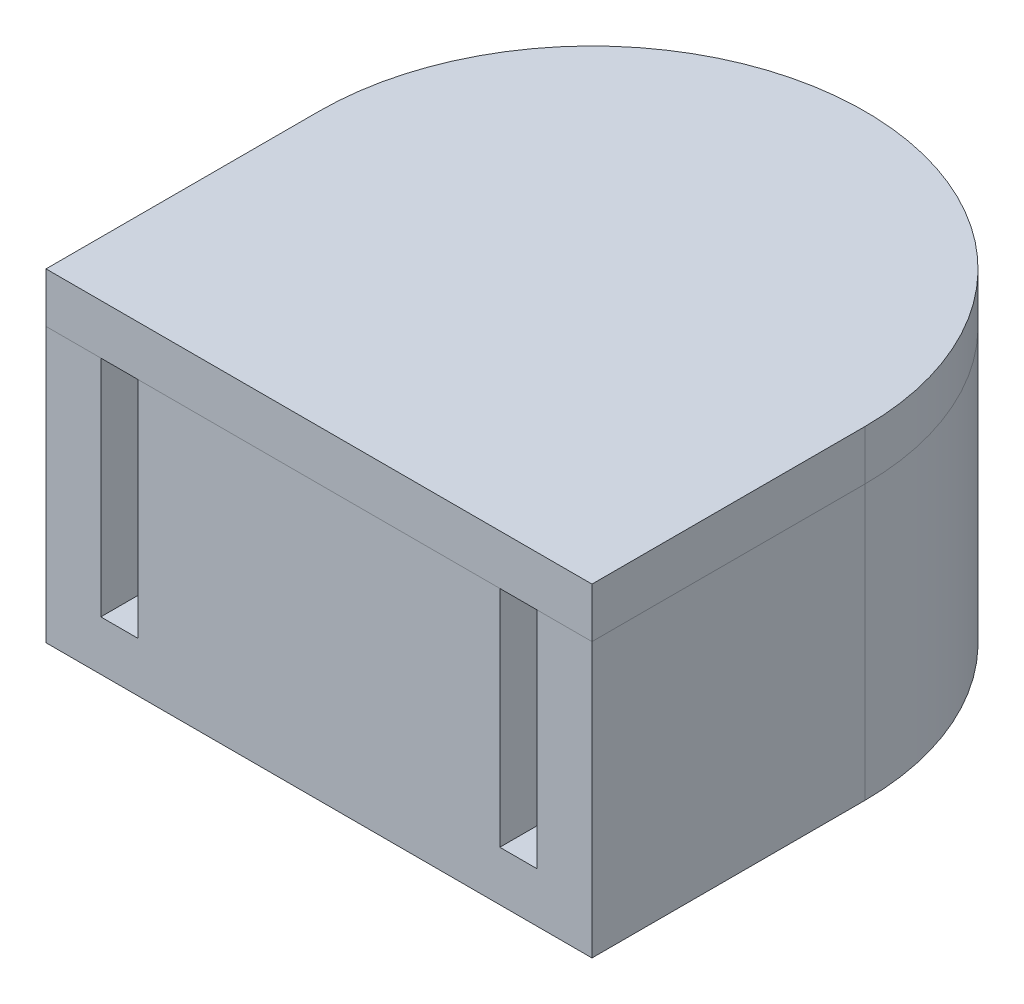
from build123d import *
from build123d.topology import SkipClean

# Parameters (mm, degrees)
BOSS_EXTRUDE1_DEPTH                       = 6
SKETCH2_R                                 = 1.495
SKETCH2_R_2                               = 0.7
BOSS_EXTRUDE2_DEPTH                       = 1
BOSS_EXTRUDE2_2_DEPTH                     = 1
BOSS_EXTRUDE2_3_DEPTH                     = 1
BOSS_EXTRUDE3_START                       = 1
SKETCH4_R                                 = 6.875
BOSS_EXTRUDE3_DEPTH                       = 1
SKETCH5_R                                 = 6.875
BOSS_EXTRUDE4_DEPTH                       = 1
BOSS_EXTRUDE5_START                       = 1
SKETCH7_R                                 = 1.495
SKETCH7_R_2                               = 0.7
BOSS_EXTRUDE5_DEPTH                       = 1
BOSS_EXTRUDE6_START                       = -2
BOSS_EXTRUDE6_DEPTH                       = 9
SKETCH9_R                                 = 10.96
SKETCH9_W                                 = 21.92
SKETCH9_H                                 = 10.96
BOSS_EXTRUDE7_DEPTH                       = 2
SKETCH10_R                                = 10.96
SKETCH10_W                                = 21.92
SKETCH10_H                                = 10.96
BOSS_EXTRUDE8_DEPTH                       = 2
CSK_FOR_0_FLAT_HEAD_MACHINE_SCREW_2_COUNT = 2
CSK_FOR_0_FLAT_HEAD_MACHINE_SCREW_2_PITCH = 3.7
CSK_FOR_0_FLAT_HEAD_MACHINE_SCREW_3_COUNT = 2
CSK_FOR_0_FLAT_HEAD_MACHINE_SCREW_3_PITCH = 16.02
CSK_FOR_0_FLAT_HEAD_MACHINE_SCREW_4_COUNT = 2
CSK_FOR_0_FLAT_HEAD_MACHINE_SCREW_4_PITCH = 19.72
CSK_FOR_0_FLAT_HEAD_MACHINE_SCREW_5_COUNT = 2
CSK_FOR_0_FLAT_HEAD_MACHINE_SCREW_5_PITCH = 22.047630258


# Read off the part's stored shape, not the designer's step: Boss-Extrude6
with BuildPart() as part:
    # Sketch1 → Boss-Extrude1 (new body)
    with BuildSketch(Plane(origin=(0, 0, 0), x_dir=(1, 0, 0), z_dir=(0, 1, 0))):
        with BuildLine():
            ThreePointArc((1.732050808, -1), (0, -2), (-1.732050808, -1))
            Line((-1.732050808, -1), (-2.424871131, -1.4))
            ThreePointArc((-2.424871131, -1.4), (-2.167128041, -2.022246864), (-2.079216672, -2.69))
            ThreePointArc((-2.079216672, -2.69), (-2.75470977, -4.430475067), (-4.427475168, -5.259571146))
            ThreePointArc((-4.427475168, -5.259571146), (0, -6.875), (4.427475168, -5.259571146))
            ThreePointArc((4.427475168, -5.259571146), (2.369136174, -3.878247159), (2.424871131, -1.4))
            Line((2.424871131, -1.4), (1.732050808, -1))
        make_face()
        with BuildLine():
            Line((0, 2.8), (0, 2))
            ThreePointArc((0, 2), (1.414213562, 1.414213562), (2, 0))
            ThreePointArc((2, 0), (1.931851653, -0.51763809), (1.732050808, -1))
            Line((1.732050808, -1), (2.424871131, -1.4))
            ThreePointArc((2.424871131, -1.4), (4.543228649, -0.112608532), (6.768659809, -1.204520397))
            ThreePointArc((6.768659809, -1.204520397), (6.848363352, -0.604602684), (6.875, 0))
            ThreePointArc((6.875, 0), (5.628555295, 3.947782959), (2.341184642, 6.464091543))
            ThreePointArc((2.341184642, 6.464091543), (2.519588893, 5.935042171), (2.58, 5.38))
            ThreePointArc((2.58, 5.38), (1.824335495, 3.555664505), (0, 2.8))
        make_face()
        with BuildLine():
            ThreePointArc((-1.732050808, -1), (-1.732050808, 1), (0, 2))
            Line((0, 2), (0, 2.8))
            ThreePointArc((0, 2.8), (-2.174092475, 3.990855691), (-2.341184642, 6.464091543))
            ThreePointArc((-2.341184642, 6.464091543), (-5.953924651, 3.4375), (-6.768659809, -1.204520397))
            ThreePointArc((-6.768659809, -1.204520397), (-4.543228649, -0.112608532), (-2.424871131, -1.4))
            Line((-2.424871131, -1.4), (-1.732050808, -1))
        make_face()
    extrude(amount=BOSS_EXTRUDE1_DEPTH)



with BuildPart() as body_2:
    # Sketch2 → Boss-Extrude2 (new body)
    with BuildSketch(Plane.XZ):
        with Locations(Location((-4.659216672, 2.69, 0), (0, 0, 270))):
            Circle(SKETCH2_R)
        with Locations(Location((-4.659216672, 2.69, 0), (0, 0, 270))):
            Circle(SKETCH2_R_2, mode=Mode.SUBTRACT)
    extrude(amount=-BOSS_EXTRUDE2_DEPTH)


with BuildPart() as body_3:
    # Sketch2 → Boss-Extrude2 2 (new body)
    with BuildSketch(Plane.XZ):
        with Locations(Location((4.659216672, 2.69, 0), (0, 0, 270))):
            Circle(SKETCH2_R)
        with Locations(Location((4.659216672, 2.69, 0), (0, 0, 270))):
            Circle(SKETCH2_R_2, mode=Mode.SUBTRACT)
    extrude(amount=-BOSS_EXTRUDE2_2_DEPTH)


with BuildPart() as body_4:
    # Sketch2 → Boss-Extrude2 3 (new body)
    with BuildSketch(Plane.XZ):
        with Locations(Location((0, -5.38, 0), (0, 0, 270))):
            Circle(SKETCH2_R)
        with Locations(Location((0, -5.38, 0), (0, 0, 270))):
            Circle(SKETCH2_R_2, mode=Mode.SUBTRACT)
    extrude(amount=-BOSS_EXTRUDE2_3_DEPTH)


with BuildPart() as part_1:
    with SkipClean():  # the faces are left unmerged after this step: merging them gives an invalid solid
        add(part.part)

        add(body_2.part)  # Boss-Extrude3 merges body 2

        add(body_3.part)  # Boss-Extrude3 merges body 3

        add(body_4.part)  # Boss-Extrude3 merges body 4
        # Sketch4 → Boss-Extrude3 (add)
        with BuildSketch(Plane.XZ.offset(BOSS_EXTRUDE3_START)):
            with Locations(Location((0, 0, 0), (0, 0, 270))):
                Circle(SKETCH4_R)
        extrude(amount=-BOSS_EXTRUDE3_DEPTH)


with BuildPart() as body_2_2:
    # Sketch5 → Boss-Extrude4 (new body)
    with BuildSketch(Plane(origin=(0, 6, 0), x_dir=(1, 0, 0), z_dir=(0, 1, 0))):
        with Locations(Location((0, 0, 0), (0, 0, 270))):
            Circle(SKETCH5_R)
    extrude(amount=BOSS_EXTRUDE4_DEPTH)

    # Sketch7 → Boss-Extrude5 (add)
    # profile 1 of 3: a face of its own
    with BuildSketch(Plane.XZ.offset(-6).offset(BOSS_EXTRUDE5_START)):
        with Locations(Location((0, -5.38, 0), (0, 0, 270))):
            Circle(SKETCH7_R)
        with Locations(Location((0, -5.38, 0), (0, 0, 270))):
            Circle(SKETCH7_R_2, mode=Mode.SUBTRACT)
    # profile 2 of 3: a face of its own
    with BuildSketch(Plane.XZ.offset(-6).offset(BOSS_EXTRUDE5_START)):
        with Locations(Location((-4.659216672, 2.69, 0), (0, 0, 149.999250854))):
            Circle(SKETCH7_R)
        with Locations(Location((-4.659216672, 2.69, 0), (0, 0, 270))):
            Circle(SKETCH7_R_2, mode=Mode.SUBTRACT)
    # profile 3 of 3: a face of its own
    with BuildSketch(Plane.XZ.offset(-6).offset(BOSS_EXTRUDE5_START)):
        with Locations(Location((4.659216672, 2.69, 0), (0, 0, 29.999250854))):
            Circle(SKETCH7_R)
        with Locations(Location((4.659216672, 2.69, 0), (0, 0, 270))):
            Circle(SKETCH7_R_2, mode=Mode.SUBTRACT)
    extrude(amount=-BOSS_EXTRUDE5_DEPTH)


with BuildPart() as body_3_2:
    # Boss-Extrude6 outline → Boss-Extrude6 (new body)
    with BuildSketch(Plane(origin=(0, 0, 0), x_dir=(1, 0, 0), z_dir=(0, 1, 0)).offset(BOSS_EXTRUDE6_START)):
        with BuildLine():
            Line((-10.96, -10.96), (-8.76, -10.96))
            Line((-8.76, -10.96), (-8.76, 0))
            ThreePointArc((-8.76, 0), (0, 8.76), (8.76, 0))
            Line((8.76, 0), (8.76, -10.96))
            Line((8.76, -10.96), (10.96, -10.96))
            Line((10.96, -10.96), (10.96, 0))
            ThreePointArc((10.96, 0), (0, 10.96), (-10.96, 0))
            Line((-10.96, 0), (-10.96, -10.96))
        make_face()
        with BuildLine():
            Line((7.26, -10.96), (7.26, -4.902040392))
            ThreePointArc((7.26, -4.902040392), (0, -8.76), (-7.26, -4.902040392))
            Line((-7.26, -4.902040392), (-7.26, -10.96))
            Line((-7.26, -10.96), (7.26, -10.96))
        make_face()
    extrude(amount=BOSS_EXTRUDE6_DEPTH)

    # Sketch9 → Boss-Extrude7 (add)
    with BuildSketch(Plane(origin=(0, -2, 0), x_dir=(1, 0, 0), z_dir=(0, 1, 0))):
        Circle(SKETCH9_R)
        with Locations((0, -5.48)):
            Rectangle(SKETCH9_W, SKETCH9_H)
    extrude(amount=-BOSS_EXTRUDE7_DEPTH)

    # Sketch15 → CSK for #0 Flat Head Machine Screw (100)5 (revolve, cut)
    with BuildSketch(Plane(origin=(-9.86, 7, 9.86), x_dir=(0, 0, 1), z_dir=(1, 0, 0))):
        Polygon((0, 0), (0, 5.209850571), (0.34925, 5), (0.34925, 0.60071), (0.94996, 0), align=None)
    csk_for_0_flat_head_machine_screw_100 = revolve(axis=Axis((-9.86, 13.35, 9.86), (0, -1, 0)), mode=Mode.SUBTRACT)

    # CSK for _0 Flat Head Machine Screw _ 2: CSK for #0 Flat Head Machine Screw (100)5 ×2
    with Locations(*[(i * CSK_FOR_0_FLAT_HEAD_MACHINE_SCREW_2_PITCH, 0, 0) for i in range(1, CSK_FOR_0_FLAT_HEAD_MACHINE_SCREW_2_COUNT)]):
        add(csk_for_0_flat_head_machine_screw_100, mode=Mode.SUBTRACT)

    # CSK for _0 Flat Head Machine Screw _ 3: CSK for #0 Flat Head Machine Screw (100)5 ×2
    with Locations(*[(i * CSK_FOR_0_FLAT_HEAD_MACHINE_SCREW_3_PITCH, 0, 0) for i in range(1, CSK_FOR_0_FLAT_HEAD_MACHINE_SCREW_3_COUNT)]):
        add(csk_for_0_flat_head_machine_screw_100, mode=Mode.SUBTRACT)

    # CSK for _0 Flat Head Machine Screw _ 4: CSK for #0 Flat Head Machine Screw (100)5 ×2
    with Locations(*[(i * CSK_FOR_0_FLAT_HEAD_MACHINE_SCREW_4_PITCH, 0, 0) for i in range(1, CSK_FOR_0_FLAT_HEAD_MACHINE_SCREW_4_COUNT)]):
        add(csk_for_0_flat_head_machine_screw_100, mode=Mode.SUBTRACT)

    # CSK for _0 Flat Head Machine Screw _ 5: CSK for #0 Flat Head Machine Screw (100)5 ×2
    with Locations(*[Vector(0.4472135954999579, 0, -0.894427190999916) * (i * CSK_FOR_0_FLAT_HEAD_MACHINE_SCREW_5_PITCH) for i in range(1, CSK_FOR_0_FLAT_HEAD_MACHINE_SCREW_5_COUNT)]):
        add(csk_for_0_flat_head_machine_screw_100, mode=Mode.SUBTRACT)


with BuildPart() as body_4_2:
    # Sketch10 → Boss-Extrude8 (new body)
    with BuildSketch(Plane(origin=(0, 7, 0), x_dir=(1, 0, 0), z_dir=(0, 1, 0))):
        Circle(SKETCH10_R)
        with Locations((0, -5.48)):
            Rectangle(SKETCH10_W, SKETCH10_H)
    extrude(amount=BOSS_EXTRUDE8_DEPTH)


solid = Compound([part_1.part, body_2_2.part, body_3_2.part, body_4_2.part])
